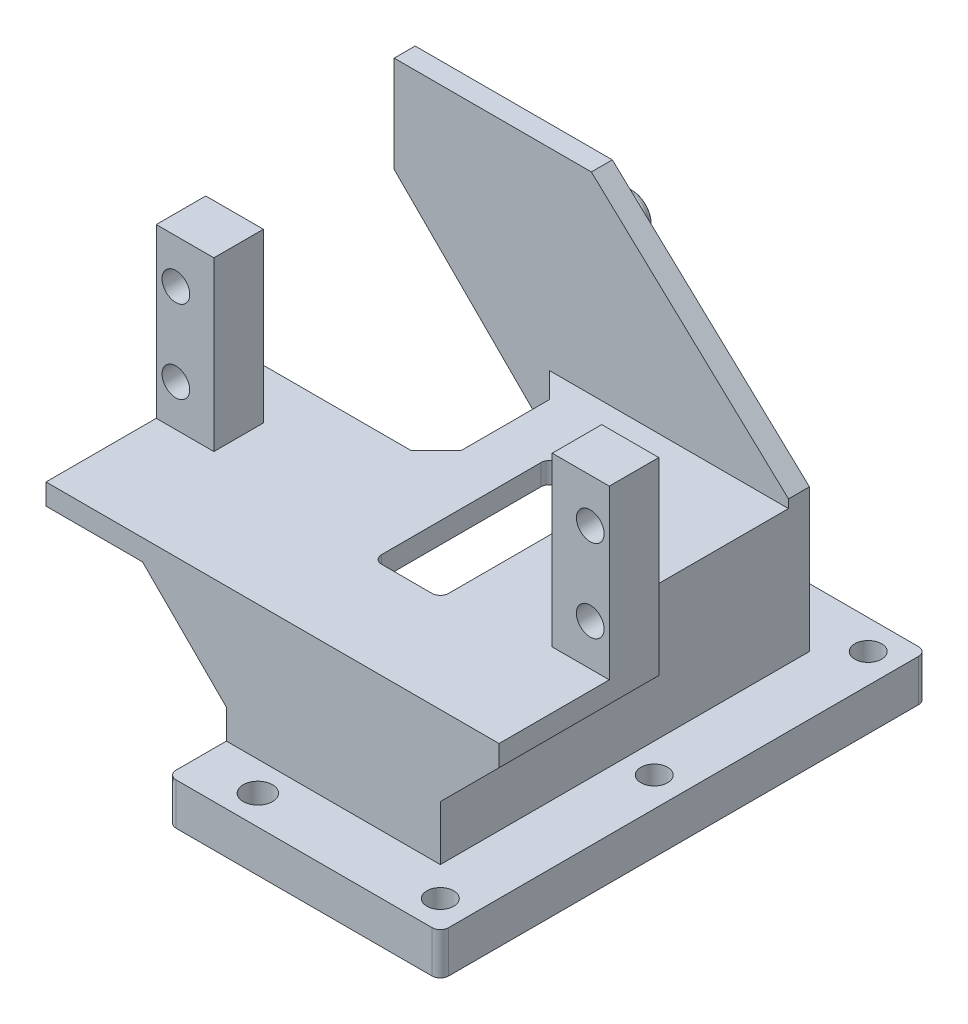
from build123d import *

# Parameters (mm, degrees)
BOSS_EXTRUDE1_DEPTH = 3.5
BOSS_EXTRUDE2_DEPTH = 21
SKETCH3_W           = 23
SKETCH3_H           = 39
BOSS_EXTRUDE3_DEPTH = 2.5
SKETCH5_W           = 21.5
SKETCH5_H           = 25
SKETCH5_W_2         = 7.07
SKETCH5_H_2         = 19.04
BOSS_EXTRUDE5_DEPTH = 2.5
SKETCH6_W           = 7.07
SKETCH6_H           = 5.9
BOSS_EXTRUDE6_DEPTH = 20
BOSS_EXTRUDE7_DEPTH = 23
FILLET1_SIZE        = 10
SKETCH9_R           = 2.475
BOSS_EXTRUDE8_DEPTH = 9
FILLET2_R           = 0.5
SKETCH10_R          = 1.65
CUT_EXTRUDE1_DEPTH  = 9
SKETCH11_W          = 0.2
SKETCH11_H          = 20
CUT_EXTRUDE2_DEPTH  = 9
CUT_EXTRUDE3_DEPTH  = 9
FILLET3_SIZE        = 3
BOSS_EXTRUDE9_DEPTH = 5
SKETCH14_R          = 1.747814763
SKETCH14_R_2        = 1.6
CUT_EXTRUDE4_DEPTH  = 15
CUT_EXTRUDE5_DEPTH  = 113
FILLET4_SIZE        = 7
FILLET5_SIZE        = 3
FILLET6_SIZE        = 3
FILLET7_R           = 1
SKETCH16_W          = 8
SKETCH16_H          = 21
CUT_EXTRUDE6_DEPTH  = 113
FILLET8_R           = 1


# Some blends are built 0.0001 mm under size
with BuildPart() as part:
    # Sketch1 → Boss-Extrude1 (new body)
    with BuildSketch(Plane(origin=(0, 0, 0), x_dir=(1, 0, 0), z_dir=(0, 1, 0))):
        Polygon((0, 40), (23, 40), (23, 79), (0, 79), (0, 100), (110, 100), (110, 79), (87, 79), (87, 40), (110, 40), (110, 20), (80, 0), (30, 0), (0, 20), align=None)
    extrude(amount=BOSS_EXTRUDE1_DEPTH)

    # Sketch2 → Boss-Extrude2 (add)
    with BuildSketch(Plane(origin=(0, 3.5, 0), x_dir=(1, 0, 0), z_dir=(0, 1, 0))):
        Polygon((0, 79), (23, 79), (23, 40), (0, 40), (0, 37.5), (25.5, 37.5), (25.5, 81.5), (0, 81.5), align=None)
        Polygon((110, 81.5), (84.5, 81.5), (84.5, 37.5), (110, 37.5), (110, 40), (87, 40), (87, 79), (110, 79), align=None)
    extrude(amount=BOSS_EXTRUDE2_DEPTH)

    # Sketch3 → Boss-Extrude3 (add)
    with BuildSketch(Plane(origin=(0, 24.5, 0), x_dir=(1, 0, 0), z_dir=(0, 1, 0))):
        with Locations((11.5, 59.5)):
            Rectangle(SKETCH3_W, SKETCH3_H)
        with Locations((98.5, 59.5)):
            Rectangle(SKETCH3_W, SKETCH3_H)
    extrude(amount=-BOSS_EXTRUDE3_DEPTH)

    # Sketch5 → Boss-Extrude5 (add)
    with BuildSketch(Plane(origin=(0, 24.5, 0), x_dir=(1, 0, 0), z_dir=(0, 1, 0))):
        with Locations((120.75, 50)):
            Rectangle(SKETCH5_W, SKETCH5_H)
        with Locations((-10.75, 50)):
            Rectangle(SKETCH5_W, SKETCH5_H)
        with Locations((29.035, 47.02)):
            Rectangle(SKETCH5_W_2, SKETCH5_H_2)
        with Locations((80.965, 47.02)):
            Rectangle(SKETCH5_W_2, SKETCH5_H_2)
    extrude(amount=-BOSS_EXTRUDE5_DEPTH)

    # Sketch6 → Boss-Extrude6 (add)
    with BuildSketch(Plane(origin=(0, 24.5, 0), x_dir=(1, 0, 0), z_dir=(0, 1, 0))):
        with Locations((29.035, 53.59)):
            Rectangle(SKETCH6_W, SKETCH6_H)
        with Locations((80.965, 53.59)):
            Rectangle(SKETCH6_W, SKETCH6_H)
        with Locations((-17.965, 53.59)):
            Rectangle(SKETCH6_W, SKETCH6_H)
        with Locations((127.965, 53.59)):
            Rectangle(SKETCH6_W, SKETCH6_H)
    extrude(amount=BOSS_EXTRUDE6_DEPTH)

    # Sketch7 → Boss-Extrude7 (add)
    with BuildSketch(Plane(origin=(0, 24.5, 0), x_dir=(1, 0, 0), z_dir=(0, 1, 0))):
        Polygon((0, 81.5), (25.5, 81.5), (25.5, 79), (0, 79), (-21.5, 79), (-21.5, 81.5), align=None)
        Polygon((110, 79), (84.5, 79), (84.5, 81.5), (110, 81.5), (131.5, 81.5), (131.5, 79), align=None)
    extrude(amount=BOSS_EXTRUDE7_DEPTH)

    # Fillet1
    # the kernel refuses this chamfer: 10 mm, written as the material it adds along each edge
    with BuildSketch(Plane(origin=(0, 22, -40), x_dir=(0.027495876610586372, -0.9996219169112968, 0), z_dir=(0, 0, 1)), Plane(origin=(110, 22, -37.5), x_dir=(-0.027495876610586317, -0.9996219169112968, 0), z_dir=(0, 0, -1)), Plane(origin=(110, 24.5, -81.5), x_dir=(0.9996219169112968, 0.027495876610586317, 0), z_dir=(0, 0, 1))) as fillet1_piece_1:
        Polygon((FILLET1_SIZE * 0.999621916911, -FILLET1_SIZE * 0.0274958766106), (-FILLET1_SIZE * 0.0274958766106, -FILLET1_SIZE * 0.999621916911), (0, 0), align=None)
    extrude(amount=2.5)
    with BuildSketch(Plane(origin=(0, 24.5, -79), x_dir=(0.027495876610586372, -0.9996219169112968, 0), z_dir=(0, 0, -1))) as fillet1_piece_2:
        Polygon((FILLET1_SIZE * 0.999621916911, FILLET1_SIZE * 0.0274958766106), (-FILLET1_SIZE * 0.0274958766106, FILLET1_SIZE * 0.999621916911), (0, 0), align=None)
    extrude(amount=2.5)

    # Sketch9 → Boss-Extrude8 (add)
    with BuildSketch(Plane(origin=(0, 0, -81.5), x_dir=(-1, 0, 0), z_dir=(0, 0, -1))):
        with Locations(Location((-114.55, 34.35, 0), (0, 0, 180))):
            Circle(SKETCH9_R)
        with Locations(Location((4.55, 34.35, 0), (0, 0, 180))):
            Circle(SKETCH9_R)
    extrude(amount=BOSS_EXTRUDE8_DEPTH)

    # Fillet2
    fillet2_edges = [part.edges().sort_by_distance(p)[0] for p in [
        (112.075, 34.35, -90.5),
        (-7.025, 34.35, -90.5),
    ]]
    fillet(fillet2_edges, radius=FILLET2_R)

    # Sketch10 → Cut-Extrude1 (cut)
    with BuildSketch(Plane.XY.offset(-50.64)):
        with Locations((129.16, 39.27)):
            Circle(SKETCH10_R)
        with Locations((129.16, 29.43)):
            Circle(SKETCH10_R)
        with Locations((79.77, 39.27)):
            Circle(SKETCH10_R)
        with Locations((79.77, 29.43)):
            Circle(SKETCH10_R)
        with Locations((-19.16, 29.43)):
            Circle(SKETCH10_R)
        with Locations((-19.16, 39.27)):
            Circle(SKETCH10_R)
        with Locations(Location((30.23, 39.27, 0), (0, 0, 180))):
            Circle(SKETCH10_R)
        with Locations(Location((30.23, 29.43, 0), (0, 0, 180))):
            Circle(SKETCH10_R)
    extrude(amount=-CUT_EXTRUDE1_DEPTH, mode=Mode.SUBTRACT)

    # Sketch11 → Cut-Extrude2 (cut)
    with BuildSketch(Plane.XY.offset(-50.64)):
        with Locations((-14.53, 34.5)):
            Rectangle(SKETCH11_W, SKETCH11_H)
        with Locations((25.6, 34.5)):
            Rectangle(SKETCH11_W, SKETCH11_H)
        with Locations((84.4, 34.5)):
            Rectangle(SKETCH11_W, SKETCH11_H)
        with Locations((124.53, 34.5)):
            Rectangle(SKETCH11_W, SKETCH11_H)
    extrude(amount=-CUT_EXTRUDE2_DEPTH, mode=Mode.SUBTRACT)

    # Sketch12 → Cut-Extrude3 (cut)
    with BuildSketch(Plane(origin=(0, 0, -81.5), x_dir=(-1, 0, 0), z_dir=(0, 0, -1))):
        Polygon((-108, 47.5), (-84.5, 25.5), (-84.5, 47.5), align=None)
        Polygon((-25.5, 25.5), (-25.5, 47.5), (-2, 47.5), align=None)
        Polygon((-120, 24.5), (-131.5, 36), (-131.5, 24.5), align=None)
        Polygon((10, 24.5), (21.5, 36), (21.5, 24.5), align=None)
    extrude(amount=-CUT_EXTRUDE3_DEPTH, mode=Mode.SUBTRACT)

    # Fillet3
    fillet3_edges = [part.edges().sort_by_distance(p)[0] for p in [
        (0, 23.25, -62.5),
        (110, 23.25, -62.5),
    ]]
    chamfer(fillet3_edges, length=FILLET3_SIZE)

    # Sketch13 → Boss-Extrude9 (add)
    with BuildSketch(Plane(origin=(0, 3.5, 0), x_dir=(1, 0, 0), z_dir=(0, 1, 0))):
        Polygon((0, 30.5), (32.5, 30.5), (32.5, 88.5), (0, 88.5), (0, 81.5), (25.5, 81.5), (25.5, 37.5), (0, 37.5), align=None)
        Polygon((84.5, 37.5), (110, 37.5), (110, 30.5), (77.5, 30.5), (77.5, 88.5), (110, 88.5), (110, 81.5), (84.5, 81.5), align=None)
    extrude(amount=BOSS_EXTRUDE9_DEPTH)

    # Sketch14 → Cut-Extrude4 (cut)
    with BuildSketch(Plane(origin=(0, 8.5, 0), x_dir=(1, 0, 0), z_dir=(0, 1, 0))):
        with Locations(Location((7.25, 34, 0), (0, 0, 270))):
            Circle(SKETCH14_R)
        with Locations(Location((7.25, 85, 0), (0, 0, 270))):
            Circle(SKETCH14_R_2)
        with Locations(Location((29, 34, 0), (0, 0, 270))):
            Circle(SKETCH14_R_2)
        with Locations(Location((29, 59.5, 0), (0, 0, 270))):
            Circle(SKETCH14_R_2)
        with Locations(Location((29, 85, 0), (0, 0, 270))):
            Circle(SKETCH14_R_2)
        with Locations(Location((81, 34, 0), (0, 0, 90))):
            Circle(SKETCH14_R_2)
        with Locations(Location((102.75, 34, 0), (0, 0, 90))):
            Circle(SKETCH14_R)
        with Locations(Location((81, 59.5, 0), (0, 0, 90))):
            Circle(SKETCH14_R_2)
        with Locations(Location((81, 85, 0), (0, 0, 90))):
            Circle(SKETCH14_R_2)
        with Locations(Location((102.75, 85, 0), (0, 0, 90))):
            Circle(SKETCH14_R_2)
    extrude(amount=-CUT_EXTRUDE4_DEPTH, mode=Mode.SUBTRACT)

    # Sketch15 → Cut-Extrude5 (cut)
    with BuildSketch(Plane(origin=(0, 0, -100), x_dir=(-1, 0, 0), z_dir=(0, 0, -1))):
        Polygon((-110, 3.5), (-32.5, 3.5), (-32.5, 47.5), (-131.5, 47.5), (-131.5, 3.5), align=None)
        Polygon((0, 0), (0, 3.5), (-32.5, 3.5), (-110, 3.5), (-110, 0), align=None)
    extrude(amount=-CUT_EXTRUDE5_DEPTH, mode=Mode.SUBTRACT)

    # Fillet4
    fillet4_edges = [part.edges().sort_by_distance(p)[0] for p in [
        (25.5, 22, -47.02),
    ]]
    chamfer(fillet4_edges, length=FILLET4_SIZE - 0.0001)  # a hair under: the kernel refuses the full size

    # Fillet5
    fillet5_edges = [part.edges().sort_by_distance(p)[0] for p in [
        (23, 12.75, -40),
        (23, 12.75, -79),
        (23, 22, -59.5),
        (6.5, 22, -40),
        (11.5, 22, -79),
    ]]
    chamfer(fillet5_edges, length=FILLET5_SIZE)

    # Fillet6
    fillet6_edges = [part.edges().sort_by_distance(p)[0] for p in [
        (0, 21.75, -79),
    ]]
    chamfer(fillet6_edges, length=FILLET6_SIZE)

    # Fillet7
    fillet7_edges = [part.edges().sort_by_distance(p)[0] for p in [
        (0, 6, -30.5),
        (32.5, 6, -30.5),
        (32.5, 6, -88.5),
        (0, 6, -88.5),
    ]]
    fillet(fillet7_edges, radius=FILLET7_R)

    # Sketch16 → Cut-Extrude6 (cut)
    with BuildSketch(Plane.XZ.offset(-22)):
        with Locations((10, -59.5)):
            Rectangle(SKETCH16_W, SKETCH16_H)
    extrude(amount=-CUT_EXTRUDE6_DEPTH, mode=Mode.SUBTRACT)

    # Fillet8
    fillet8_edges = [part.edges().sort_by_distance(p)[0] for p in [
        (6, 23.25, -70),
        (6, 23.25, -49),
        (14, 23.25, -49),
        (14, 23.25, -70),
    ]]
    fillet(fillet8_edges, radius=FILLET8_R)


solid = part.part
